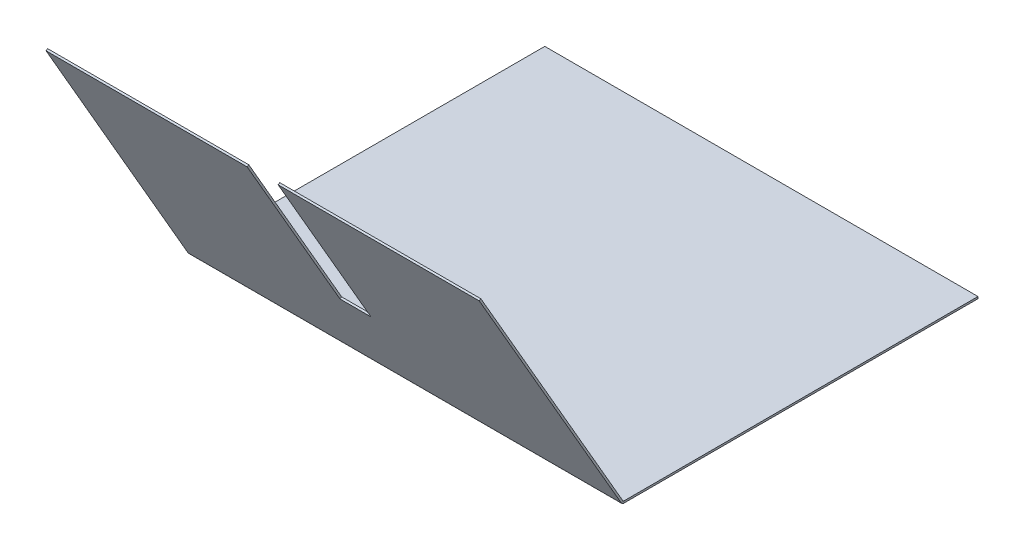
from build123d import *

# Parameters (mm, degrees)
BASE_FLANGE1_DEPTH = 355.6
SKETCH6_W          = 25.4
SKETCH6_H          = 152.4
CUT_EXTRUDE1_DEPTH = 533.597507197


# Sheet-metal steps are written as plain solids
with BuildPart() as part:
    # Sketch1 → Base-Flange1 (new body)
    with BuildSketch(Plane(origin=(0, 0, 0), x_dir=(0, 0, -1), z_dir=(1, 0, 0))):
        with BuildLine():
            Line((0, 0), (-290.758180239, 0))
            ThreePointArc((-290.758180239, 0), (-291.920230239, 0.311370359), (-292.77090988, 1.16205))
            Line((-292.77090988, 1.16205), (-409.417574699, 203.2))
            Line((-409.417574699, 203.2), (-408.042759371, 203.99375))
            Line((-408.042759371, 203.99375), (-291.396094552, 1.9558))
            ThreePointArc((-291.396094552, 1.9558), (-291.126480239, 1.686185688), (-290.758180239, 1.5875))
            Line((-290.758180239, 1.5875), (0, 1.5875))
            Line((0, 1.5875), (0, 0))
        make_face()
    extrude(amount=-BASE_FLANGE1_DEPTH)

    # Sketch6 → Cut-Extrude1 (cut, through all)
    with BuildSketch(Plane(origin=(0, -126.483010223, 219.075), x_dir=(1, 0, 0), z_dir=(0, -0.4999999999999979, 0.8660254037844399))):
        with Locations((-177.8, 304.485149399)):
            Rectangle(SKETCH6_W, SKETCH6_H)
    extrude(amount=-CUT_EXTRUDE1_DEPTH, mode=Mode.SUBTRACT)


solid = part.part
